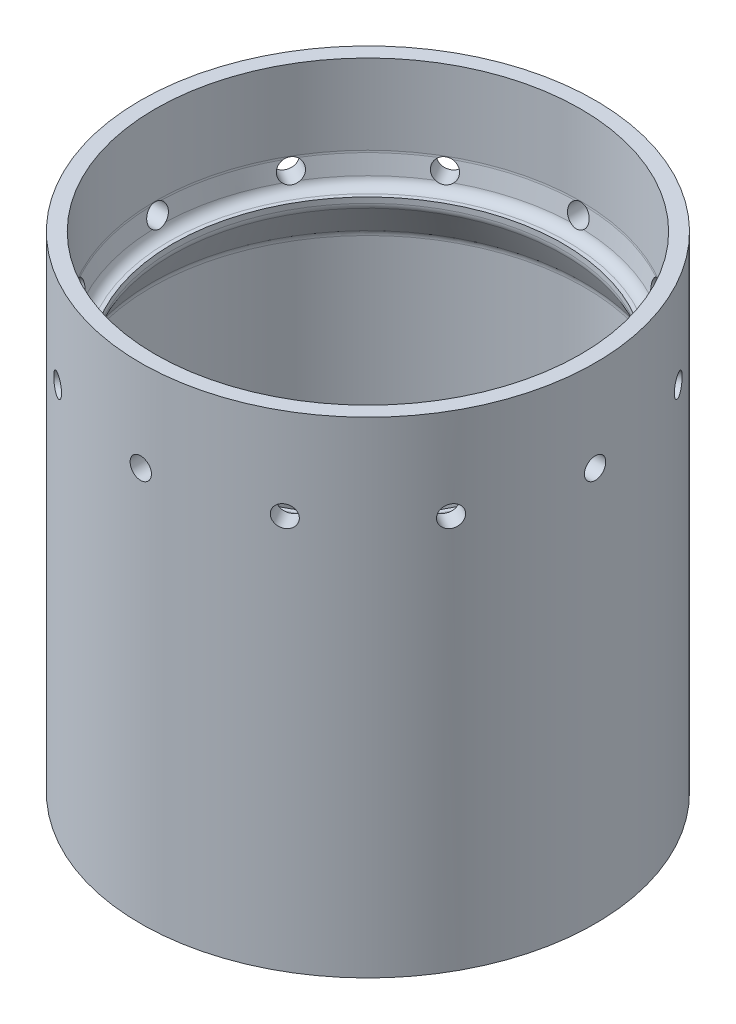
from build123d import *

# Parameters (mm, degrees)
RADIUS_R                      = 3.175
F_0_257_DIAMETER_HOLE1_REACH  = 195.98
F_0_257_DIAMETER_HOLE1_BORE_R = 3.2639
F_1_4_20_TAPPED_HOLE1_D       = 5.1054
F_1_4_20_TAPPED_HOLE1_DEPTH   = 12.7
F_1_4_20_TAPPED_HOLE1_TIP     = 1.533816902
CIRPATTERN1_COUNT             = 12


with BuildPart() as part:
    # Sketch2 → Revolve1 (revolve)
    with BuildSketch(Plane.XY, mode=Mode.PRIVATE) as revolve1_sk:
        Polygon((59.69, 0), (63.5254, 0), (65.1129, 8.255), (65.1129, 33.02), (69.6341, 33.02), (69.6341, -115.688448759), (57.15, -115.688448759), (59.69, -111.289039708), (59.69, -102.988448759), (66.3575, -91.44), (66.3575, -14.088448759), (59.69, -2.54), align=None)
    revolve(revolve1_sk.sketch.rotate(Axis((0, 0, 0), (0, -1, 0)), 180), axis=Axis((0, 0, 0), (0, -1, 0)))

    # Radius
    radius_edges = [part.edges().sort_by_distance(p)[0] for p in [
        (65.1129, 8.255, 0),
        (59.69, -111.289039708, 0),
        (59.69, -102.988448759, 0),
        (66.3575, -91.44, 0),
        (66.3575, -14.088448759, 0),
        (59.69, -2.54, 0),
        (63.5254, 0, 0),
    ]]
    fillet(radius_edges, radius=RADIUS_R)

    # F (0.257) Diameter Hole1 bore → F (0.257) Diameter Hole1 (cut, up to next)
    with BuildSketch(Plane.XY.offset(69.6341), mode=Mode.PRIVATE) as f_0_257_diameter_hole1_sk1:
        with Locations((0, 5.1181)):
            Circle(F_0_257_DIAMETER_HOLE1_BORE_R)
    f_0_257_diameter_hole1_tool1 = extrude(f_0_257_diameter_hole1_sk1.sketch, amount=-F_0_257_DIAMETER_HOLE1_REACH, mode=Mode.PRIVATE) & part.part
    f_0_257_diameter_hole1 = f_0_257_diameter_hole1_tool1.solids().sort_by_distance((0, 5.1181, 69.6341))[0]
    add(f_0_257_diameter_hole1, mode=Mode.SUBTRACT)

    # 1/4-20 Tapped Hole1
    with Locations(Plane.XZ.offset(115.688448759)):
        with Locations((0, 64.516), (61.358362205, 19.936540409), (37.921553337, -52.194540409), (-37.921553337, -52.194540409), (-61.358362205, 19.936540409)):
            Hole(F_1_4_20_TAPPED_HOLE1_D / 2, depth=F_1_4_20_TAPPED_HOLE1_DEPTH)
            with Locations((0, 0, -(F_1_4_20_TAPPED_HOLE1_DEPTH + F_1_4_20_TAPPED_HOLE1_TIP / 2))):  # 118° drill point
                Cone(0, F_1_4_20_TAPPED_HOLE1_D / 2, F_1_4_20_TAPPED_HOLE1_TIP, mode=Mode.SUBTRACT)

    # CirPattern1: F (0.257) Diameter Hole1; each copy of F (0.257) Diameter Hole1 runs up to whatever stops it at its own place
    cirpattern1_before = part.part  # the part as the pattern finds it: every copy runs up to it
    cirpattern1_f_0_257_diameter_hole1_long = extrude(f_0_257_diameter_hole1_sk1.sketch, amount=-F_0_257_DIAMETER_HOLE1_REACH, mode=Mode.PRIVATE)
    cirpattern1_f_0_257_diameter_hole1_tool1 = cirpattern1_f_0_257_diameter_hole1_long.rotate(Axis((0, 0, 0), (0, 1, 0)), 1 * 360 / CIRPATTERN1_COUNT) & cirpattern1_before
    add(cirpattern1_f_0_257_diameter_hole1_tool1.solids().sort_by_distance((34.81705, 5.1181, 60.3049))[0], mode=Mode.SUBTRACT)
    cirpattern1_f_0_257_diameter_hole1_tool2 = cirpattern1_f_0_257_diameter_hole1_long.rotate(Axis((0, 0, 0), (0, 1, 0)), 2 * 360 / CIRPATTERN1_COUNT) & cirpattern1_before
    add(cirpattern1_f_0_257_diameter_hole1_tool2.solids().sort_by_distance((60.3049, 5.1181, 34.81705))[0], mode=Mode.SUBTRACT)
    cirpattern1_f_0_257_diameter_hole1_tool3 = cirpattern1_f_0_257_diameter_hole1_long.rotate(Axis((0, 0, 0), (0, 1, 0)), 3 * 360 / CIRPATTERN1_COUNT) & cirpattern1_before
    add(cirpattern1_f_0_257_diameter_hole1_tool3.solids().sort_by_distance((69.6341, 5.1181, 0))[0], mode=Mode.SUBTRACT)
    cirpattern1_f_0_257_diameter_hole1_tool4 = cirpattern1_f_0_257_diameter_hole1_long.rotate(Axis((0, 0, 0), (0, 1, 0)), 4 * 360 / CIRPATTERN1_COUNT) & cirpattern1_before
    add(cirpattern1_f_0_257_diameter_hole1_tool4.solids().sort_by_distance((60.3049, 5.1181, -34.81705))[0], mode=Mode.SUBTRACT)
    cirpattern1_f_0_257_diameter_hole1_tool5 = cirpattern1_f_0_257_diameter_hole1_long.rotate(Axis((0, 0, 0), (0, 1, 0)), 5 * 360 / CIRPATTERN1_COUNT) & cirpattern1_before
    add(cirpattern1_f_0_257_diameter_hole1_tool5.solids().sort_by_distance((34.81705, 5.1181, -60.3049))[0], mode=Mode.SUBTRACT)
    cirpattern1_f_0_257_diameter_hole1_tool6 = cirpattern1_f_0_257_diameter_hole1_long.rotate(Axis((0, 0, 0), (0, 1, 0)), 6 * 360 / CIRPATTERN1_COUNT) & cirpattern1_before
    add(cirpattern1_f_0_257_diameter_hole1_tool6.solids().sort_by_distance((0, 5.1181, -69.6341))[0], mode=Mode.SUBTRACT)
    cirpattern1_f_0_257_diameter_hole1_tool7 = cirpattern1_f_0_257_diameter_hole1_long.rotate(Axis((0, 0, 0), (0, 1, 0)), 7 * 360 / CIRPATTERN1_COUNT) & cirpattern1_before
    add(cirpattern1_f_0_257_diameter_hole1_tool7.solids().sort_by_distance((-34.81705, 5.1181, -60.3049))[0], mode=Mode.SUBTRACT)
    cirpattern1_f_0_257_diameter_hole1_tool8 = cirpattern1_f_0_257_diameter_hole1_long.rotate(Axis((0, 0, 0), (0, 1, 0)), 8 * 360 / CIRPATTERN1_COUNT) & cirpattern1_before
    add(cirpattern1_f_0_257_diameter_hole1_tool8.solids().sort_by_distance((-60.3049, 5.1181, -34.81705))[0], mode=Mode.SUBTRACT)
    cirpattern1_f_0_257_diameter_hole1_tool9 = cirpattern1_f_0_257_diameter_hole1_long.rotate(Axis((0, 0, 0), (0, 1, 0)), 9 * 360 / CIRPATTERN1_COUNT) & cirpattern1_before
    add(cirpattern1_f_0_257_diameter_hole1_tool9.solids().sort_by_distance((-69.6341, 5.1181, 0))[0], mode=Mode.SUBTRACT)
    cirpattern1_f_0_257_diameter_hole1_tool10 = cirpattern1_f_0_257_diameter_hole1_long.rotate(Axis((0, 0, 0), (0, 1, 0)), 10 * 360 / CIRPATTERN1_COUNT) & cirpattern1_before
    add(cirpattern1_f_0_257_diameter_hole1_tool10.solids().sort_by_distance((-60.3049, 5.1181, 34.81705))[0], mode=Mode.SUBTRACT)
    cirpattern1_f_0_257_diameter_hole1_tool11 = cirpattern1_f_0_257_diameter_hole1_long.rotate(Axis((0, 0, 0), (0, 1, 0)), 11 * 360 / CIRPATTERN1_COUNT) & cirpattern1_before
    add(cirpattern1_f_0_257_diameter_hole1_tool11.solids().sort_by_distance((-34.81705, 5.1181, 60.3049))[0], mode=Mode.SUBTRACT)


solid = part.part
